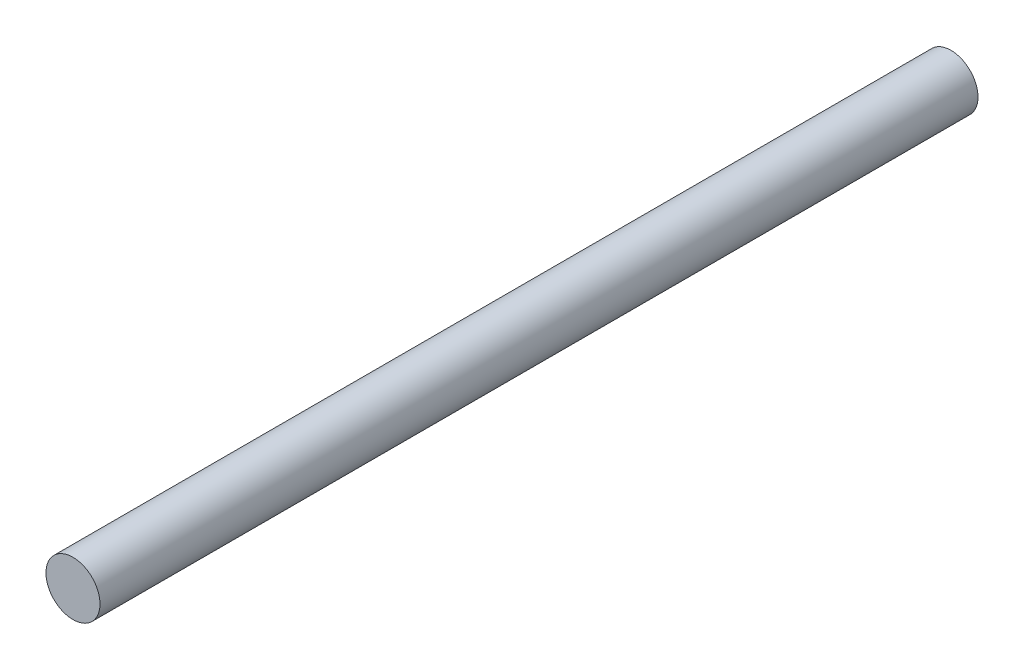
from build123d import *

# Parameters (mm, degrees)
SKETCH2_R           = 4
BOSS_EXTRUDE1_DEPTH = 130


with BuildPart() as part:
    # Sketch2 → Boss-Extrude1 (new body)
    with BuildSketch(Plane.XY):
        Circle(SKETCH2_R)
    extrude(amount=BOSS_EXTRUDE1_DEPTH)


solid = part.part
